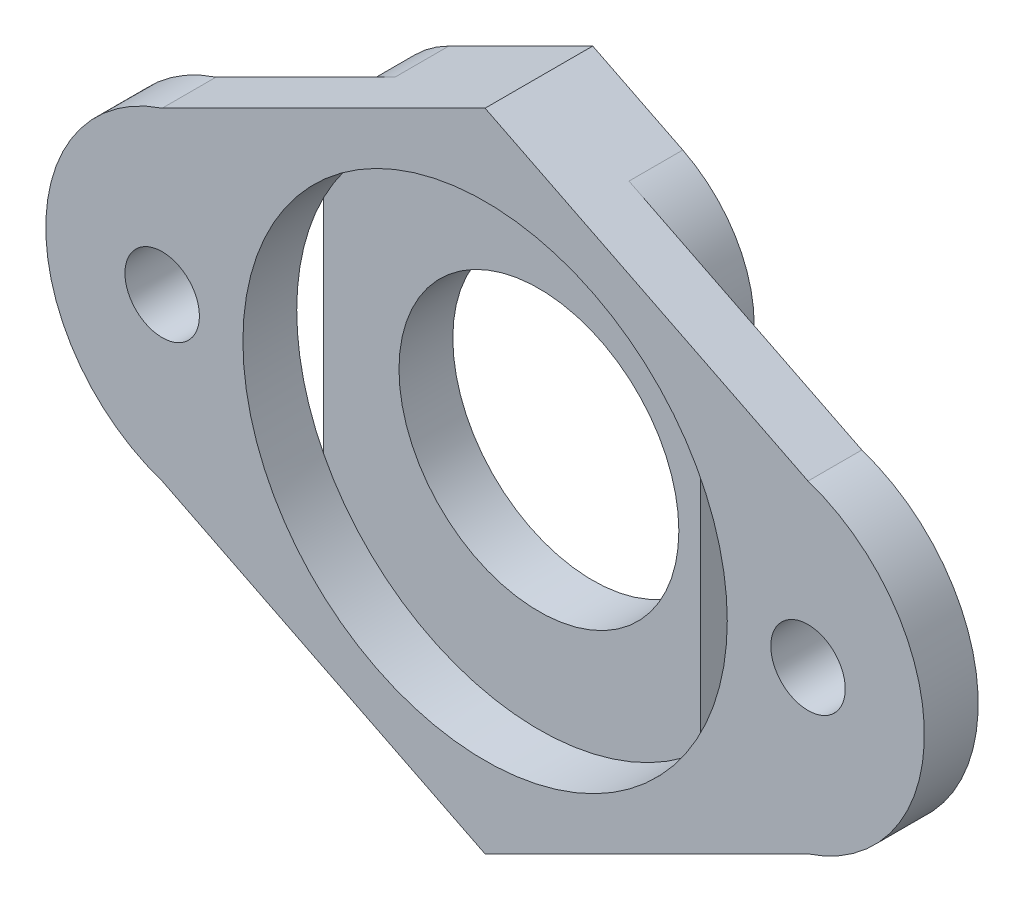
from build123d import *

# Parameters (mm, degrees)
BOSS_EXTRUDE1_DEPTH         = 6.35
TAP_DRILL_FOR_8_HELICOIL2_D = 4.3942
SKETCH5_R                   = 14.2875
CUT_EXTRUDE1_DEPTH          = 3.175
SKETCH6_W                   = 13.215231571
SKETCH6_H                   = 25.4
SKETCH6_W_2                 = 16.390231571
SKETCH6_H_2                 = 28.575
CUT_EXTRUDE2_DEPTH          = 3.175
FILLET1_R                   = 7.62
SKETCH7_R                   = 8.255
CUT_EXTRUDE3_DEPTH          = 47.513779973


with BuildPart() as part:
    # Sketch2 → Boss-Extrude1 (new body)
    with BuildSketch(Plane.XY):
        with BuildLine():
            Line((0, 0), (-19.05, -9.525))
            ThreePointArc((-19.05, -9.525), (-25.915231571, -19.05), (-19.05, -28.575))
            Line((-19.05, -28.575), (0, -38.1))
            Line((0, -38.1), (19.05, -28.575))
            ThreePointArc((19.05, -28.575), (25.915231571, -19.05), (19.05, -9.525))
            Line((19.05, -9.525), (0, 0))
        make_face()
    extrude(amount=BOSS_EXTRUDE1_DEPTH)

    # Tap Drill for #8 Helicoil2 (through all)
    with Locations(Plane.XY.offset(6.35)):
        with Locations((-19.05, -19.05), (19.05, -19.05)):
            Hole(TAP_DRILL_FOR_8_HELICOIL2_D / 2)

    # Sketch5 → Cut-Extrude1 (cut)
    with BuildSketch(Plane.XY.offset(6.35)):
        with Locations((0, -19.05)):
            Circle(SKETCH5_R)
    extrude(amount=-CUT_EXTRUDE1_DEPTH, mode=Mode.SUBTRACT)

    # Sketch6 → Cut-Extrude2 (cut)
    with BuildSketch(Plane(origin=(0, 0, 0), x_dir=(-1, 0, 0), z_dir=(0, 0, -1))):
        with Locations((19.307615786, -19.05)):
            Rectangle(SKETCH6_W, SKETCH6_H)
        with Locations((-17.720115786, -19.05)):
            Rectangle(SKETCH6_W_2, SKETCH6_H_2)
    extrude(amount=-CUT_EXTRUDE2_DEPTH, mode=Mode.SUBTRACT)

    # Fillet1
    # the kernel refuses this fillet: 7.62 mm, written as the material it takes off along each edge
    with BuildSketch(Plane(origin=(-12.7, -31.75, -11.773547486), x_dir=(0.8944271909999157, -0.44721359549995826, 0), z_dir=(0, 0, 1)), Plane(origin=(-12.7, -6.35, -11.773547486), x_dir=(0, -1, 0), z_dir=(0, 0, 1)), Plane(origin=(9.525, -4.7625, -11.773547486), x_dir=(-0.894427190999916, 0.4472135954999576, 0), z_dir=(0, 0, 1))) as fillet1_piece_1:
        with BuildLine():
            CenterArc((FILLET1_R * 0.61803398875, FILLET1_R), FILLET1_R, 206.565051177, 63.434948823)
            Line((-FILLET1_R * 0.27639320225, FILLET1_R * 0.5527864045), (0, 0))
            Line((0, 0), (FILLET1_R * 0.61803398875, 0))
        make_face()
    extrude(amount=14.948547486, mode=Mode.SUBTRACT)
    with BuildSketch(Plane(origin=(9.525, -33.3375, -11.773547486), x_dir=(-0.8944271909999163, -0.4472135954999572, 0), z_dir=(0, 0, 1))) as fillet1_piece_2:
        with BuildLine():
            CenterArc((FILLET1_R * 0.61803398875, -FILLET1_R), FILLET1_R, 90, 63.434948823)
            Line((-FILLET1_R * 0.27639320225, -FILLET1_R * 0.5527864045), (0, 0))
            Line((0, 0), (FILLET1_R * 0.61803398875, 0))
        make_face()
    extrude(amount=14.948547486, mode=Mode.SUBTRACT)

    # Sketch7 → Cut-Extrude3 (cut, through all)
    with BuildSketch(Plane(origin=(0, 0, 0), x_dir=(-1, 0, 0), z_dir=(0, 0, -1))):
        with Locations((0, -19.05)):
            Circle(SKETCH7_R)
    extrude(amount=-CUT_EXTRUDE3_DEPTH, mode=Mode.SUBTRACT)


solid = part.part
